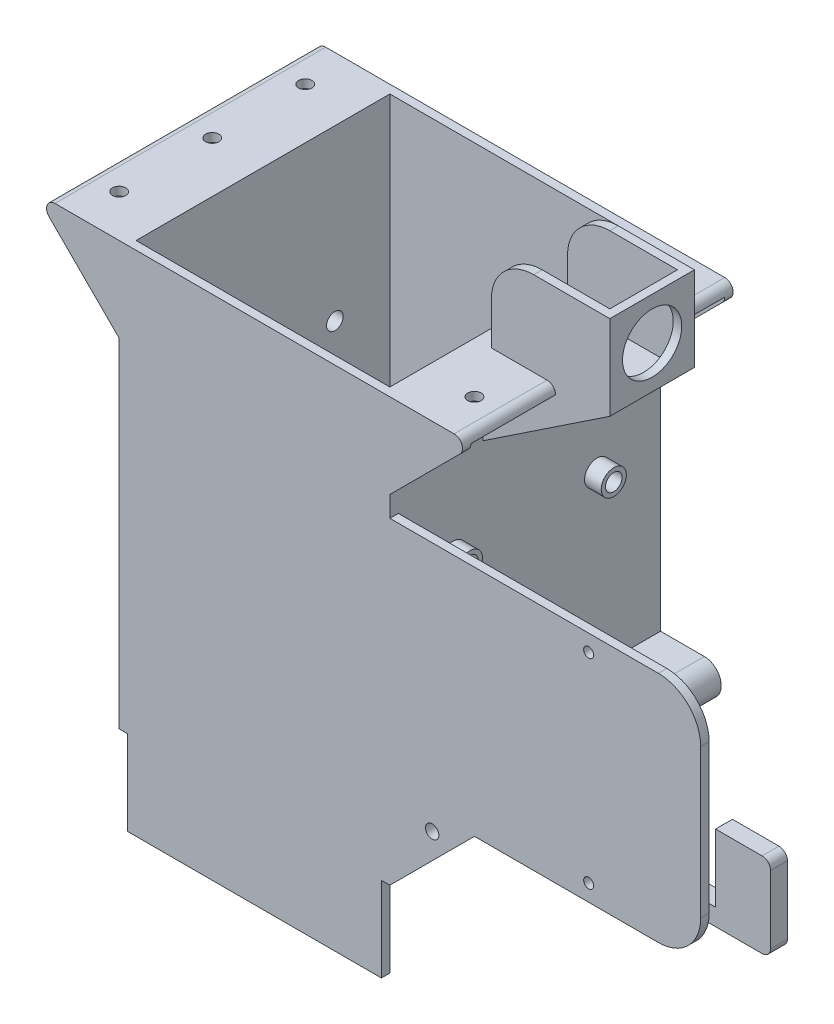
from build123d import *

# Parameters (mm, degrees)
SKETCH1_W            = 81.28
SKETCH1_H            = 81.28
SKETCH1_W_2          = 76.2
SKETCH1_H_2          = 76.2
BOSS_EXTRUDE1_DEPTH  = 177.8
SKETCH2_W            = 2.54
SKETCH2_H            = 38.1
BOSS_EXTRUDE2_DEPTH  = 25.4
SKETCH3_W            = 2.54
SKETCH3_H            = 25.4
CUT_EXTRUDE1_DEPTH   = 212.720846399
BOSS_EXTRUDE3_DEPTH  = 12.7
BOSS_EXTRUDE4_DEPTH  = 12.7
SKETCH14_W           = 5.08
SKETCH14_H           = 25.4
BOSS_EXTRUDE6_DEPTH  = 76.2
CUT_EXTRUDE2_REACH   = 243.407
SKETCH16_W           = 24.13
SKETCH16_H           = 20.32
SKETCH22_R           = 2
CUT_EXTRUDE6_DEPTH   = 252.036309724
SKETCH28_W           = 25.4
SKETCH28_H           = 50.8
BOSS_EXTRUDE7_DEPTH  = 38.1
CUT_EXTRUDE8_REACH   = 245.43
SKETCH32_W           = 33.02
SKETCH32_H           = 20.32
CUT_EXTRUDE9_DEPTH   = 25.4
CUT_EXTRUDE13_REACH  = 245.27
SKETCH34_R           = 8.89
BOSS_EXTRUDE9_DEPTH  = 2.54
SKETCH38_W           = 2.54
SKETCH38_H           = 25.4
CUT_EXTRUDE15_DEPTH  = 63.5
CUT_EXTRUDE17_REACH  = 224.71
SKETCH40_R           = 2.5
BOSS_EXTRUDE10_START = 5
SKETCH41_R           = 3.77
SKETCH41_R_2         = 2.5
BOSS_EXTRUDE10_DEPTH = 5
SKETCH42_R           = 3.77
SKETCH42_R_2         = 2.5
BOSS_EXTRUDE11_DEPTH = 5
SKETCH43_W           = 76.2
SKETCH43_H           = 76.2
CUT_EXTRUDE20_DEPTH  = 25.4
SKETCH44_W           = 174.6
SKETCH44_H           = 70
SKETCH44_R           = 1.5
BOSS_EXTRUDE12_DEPTH = 2.54
BOSS_EXTRUDE13_DEPTH = 2.54
BOSS_EXTRUDE14_DEPTH = 2.54
BOSS_EXTRUDE15_REACH = 264.115
BOSS_EXTRUDE16_DEPTH = 2.54
BOSS_EXTRUDE17_DEPTH = 2.54
BOSS_EXTRUDE18_REACH = 264.115
SKETCH51_R           = 2
CUT_EXTRUDE21_DEPTH  = 2.54
FILLET1_R            = 5.08
FILLET2_R            = 12.7
FILLET3_R            = 2.54
FILLET4_R            = 2.54
FILLET5_R            = 2.54
FILLET7_R            = 12.7
FILLET9_R            = 12.7


with BuildPart() as part:
    # Sketch1 → Boss-Extrude1 (new body)
    with BuildSketch(Plane(origin=(0, 0, 0), x_dir=(1, 0, 0), z_dir=(0, 1, 0))):
        with Locations((40.64, 40.64)):
            Rectangle(SKETCH1_W, SKETCH1_H)
        with Locations((40.64, 40.64)):
            Rectangle(SKETCH1_W_2, SKETCH1_H_2, mode=Mode.SUBTRACT)
    extrude(amount=BOSS_EXTRUDE1_DEPTH)

    # Sketch2 → Boss-Extrude2 (add)
    with BuildSketch(Plane(origin=(0, 0, 0), x_dir=(0, 0, -1), z_dir=(1, 0, 0))):
        with Locations((64.77, 19.05)):
            Rectangle(SKETCH2_W, SKETCH2_H)
    extrude(amount=-BOSS_EXTRUDE2_DEPTH)

    # Sketch3 → Cut-Extrude1 (cut, through all)
    with BuildSketch(Plane.XY):
        with Locations((80.01, 12.7)):
            Rectangle(SKETCH3_W, SKETCH3_H)
    extrude(amount=-CUT_EXTRUDE1_DEPTH, mode=Mode.SUBTRACT)

    # Sketch7 → Boss-Extrude3 (add)
    with BuildSketch(Plane.XY):
        Polygon((81.28, 25.4), (106.68, 50.8), (81.28, 50.8), align=None)
    extrude(amount=-BOSS_EXTRUDE3_DEPTH)

    # Sketch10 → Boss-Extrude4 (add)
    with BuildSketch(Plane(origin=(0, 0, -81.28), x_dir=(-1, 0, 0), z_dir=(0, 0, -1))):
        Polygon((-81.28, 25.4), (-81.28, 50.8), (-106.68, 50.8), align=None)
    extrude(amount=-BOSS_EXTRUDE4_DEPTH)

    # Sketch14 → Boss-Extrude6 (add)
    with BuildSketch(Plane(origin=(81.28, 0, 0), x_dir=(0, 0, -1), z_dir=(1, 0, 0))):
        with Locations((40.64, 38.1)):
            Rectangle(SKETCH14_W, SKETCH14_H)
    extrude(amount=BOSS_EXTRUDE6_DEPTH)

    # Sketch16 → Cut-Extrude2 (cut, up to next)
    with BuildSketch(Plane.XY.offset(-38.1), mode=Mode.PRIVATE) as cut_extrude2_sk1:
        with Locations((128.905, 40.64)):
            Rectangle(SKETCH16_W, SKETCH16_H)
    cut_extrude2_tool1 = extrude(cut_extrude2_sk1.sketch, amount=-CUT_EXTRUDE2_REACH, mode=Mode.PRIVATE) & part.part
    add(cut_extrude2_tool1.solids().sort_by_distance((128.905, 40.64, -38.1))[0], mode=Mode.SUBTRACT)

    # Sketch22 → Cut-Extrude6 (cut, through all)
    with BuildSketch(Plane.XY):
        with Locations((93.98, 45.72)):
            Circle(SKETCH22_R)
    extrude(amount=-CUT_EXTRUDE6_DEPTH, mode=Mode.SUBTRACT)

    # Sketch28 → Boss-Extrude7 (add)
    with BuildSketch(Plane(origin=(81.28, 0, 0), x_dir=(0, 0, -1), z_dir=(1, 0, 0))):
        with Locations((40.64, 152.4)):
            Rectangle(SKETCH28_W, SKETCH28_H)
    extrude(amount=BOSS_EXTRUDE7_DEPTH)

    # Sketch30 → Cut-Extrude8 (cut, up to next)
    with BuildSketch(Plane.XY.offset(-27.94), mode=Mode.PRIVATE) as cut_extrude8_sk1:
        Polygon((81.28, 127), (119.38, 127), (119.38, 152.4), align=None)
    cut_extrude8_tool1 = extrude(cut_extrude8_sk1.sketch, amount=-CUT_EXTRUDE8_REACH, mode=Mode.PRIVATE) & part.part
    add(cut_extrude8_tool1.solids().sort_by_distance((106.68, 135.466667, -27.94))[0], mode=Mode.SUBTRACT)

    # Sketch32 → Cut-Extrude9 (cut)
    with BuildSketch(Plane(origin=(0, 177.8, 0), x_dir=(1, 0, 0), z_dir=(0, 1, 0))):
        with Locations((100.33, 40.64)):
            Rectangle(SKETCH32_W, SKETCH32_H)
    extrude(amount=-CUT_EXTRUDE9_DEPTH, mode=Mode.SUBTRACT)

    # Cut-Extrude13: up to this face of the body (flat: up to its plane)
    cut_extrude13_end = Plane(part.part.faces().sort_by_distance((78.74, 101.6, -40.64))[0])
    # Sketch34 → Cut-Extrude13 (cut, up to the picked face)
    with BuildSketch(Plane(origin=(119.38, 0, 0), x_dir=(0, 0, -1), z_dir=(1, 0, 0)), mode=Mode.PRIVATE) as cut_extrude13_sk1:
        with Locations(Location((40.64, 165.1, 0), (0, 0, 180))):
            Circle(SKETCH34_R)
    cut_extrude13_tool1 = split(extrude(cut_extrude13_sk1.sketch, amount=-CUT_EXTRUDE13_REACH, mode=Mode.PRIVATE), bisect_by=cut_extrude13_end, keep=Keep.BOTH, mode=Mode.PRIVATE)
    add(cut_extrude13_tool1.solids().sort_by(Axis((119.38, 165.1, -40.64), (-1, 0, 0)))[0], mode=Mode.SUBTRACT)

    # Sketch37 → Boss-Extrude9 (add)
    with BuildSketch(Plane.XY.offset(-63.5)):
        Polygon((-25.4, 38.1), (0, 38.1), (0, 52.764696837), align=None)
    extrude(amount=-BOSS_EXTRUDE9_DEPTH)

    # Sketch38 → Cut-Extrude15 (cut)
    with BuildSketch(Plane.XY):
        with Locations((1.27, 12.7)):
            Rectangle(SKETCH38_W, SKETCH38_H)
    extrude(amount=-CUT_EXTRUDE15_DEPTH, mode=Mode.SUBTRACT)

    # Cut-Extrude17: up to this face of the body (flat: up to its plane)
    cut_extrude17_end = Plane(part.part.faces().sort_by_distance((0, 99.23335202, -41.514066738))[0])
    # Sketch40 → Cut-Extrude17 (cut, up to the picked face)
    with BuildSketch(Plane(origin=(81.28, 0, 0), x_dir=(0, 0, -1), z_dir=(1, 0, 0)), mode=Mode.PRIVATE) as cut_extrude17_sk1:
        with Locations((19.05, 101.6)):
            Circle(SKETCH40_R)
    cut_extrude17_tool1 = split(extrude(cut_extrude17_sk1.sketch, amount=-CUT_EXTRUDE17_REACH, mode=Mode.PRIVATE), bisect_by=cut_extrude17_end, keep=Keep.BOTH, mode=Mode.PRIVATE)
    # Sketch40 → Cut-Extrude17 (cut, up to the picked face)
    with BuildSketch(Plane(origin=(81.28, 0, 0), x_dir=(0, 0, -1), z_dir=(1, 0, 0)), mode=Mode.PRIVATE) as cut_extrude17_sk2:
        with Locations((62.23, 101.6)):
            Circle(SKETCH40_R)
    cut_extrude17_tool2 = split(extrude(cut_extrude17_sk2.sketch, amount=-CUT_EXTRUDE17_REACH, mode=Mode.PRIVATE), bisect_by=cut_extrude17_end, keep=Keep.BOTH, mode=Mode.PRIVATE)
    add(cut_extrude17_tool1.solids().sort_by(Axis((81.28, 101.6, -19.05), (-1, 0, 0)))[0], mode=Mode.SUBTRACT)
    add(cut_extrude17_tool2.solids().sort_by(Axis((81.28, 101.6, -62.23), (-1, 0, 0)))[0], mode=Mode.SUBTRACT)

    # Sketch41 → Boss-Extrude10 (add)
    # profile 1 of 2: a face of its own
    with BuildSketch(Plane(origin=(81.28, 0, 0), x_dir=(0, 0, -1), z_dir=(1, 0, 0)).offset(BOSS_EXTRUDE10_START)):
        with Locations(Location((19.05, 101.6, 0), (0, 0, 180))):
            Circle(SKETCH41_R)
        with Locations((19.05, 101.6)):
            Circle(SKETCH41_R_2, mode=Mode.SUBTRACT)
    # profile 2 of 2: a face of its own
    with BuildSketch(Plane(origin=(81.28, 0, 0), x_dir=(0, 0, -1), z_dir=(1, 0, 0)).offset(BOSS_EXTRUDE10_START)):
        with Locations(Location((62.23, 101.6, 0), (0, 0, 180))):
            Circle(SKETCH41_R)
        with Locations((62.23, 101.6)):
            Circle(SKETCH41_R_2, mode=Mode.SUBTRACT)
    extrude(amount=-BOSS_EXTRUDE10_DEPTH)

    # Sketch42 → Boss-Extrude11 (add)
    # profile 1 of 2: a face of its own
    with BuildSketch(Plane.ZY):
        with Locations((-62.23, 101.6)):
            Circle(SKETCH42_R)
        with Locations(Location((-62.23, 101.6, 0), (0, 0, 180))):
            Circle(SKETCH42_R_2, mode=Mode.SUBTRACT)
    # profile 2 of 2: a face of its own
    with BuildSketch(Plane.ZY):
        with Locations((-19.05, 101.6)):
            Circle(SKETCH42_R)
        with Locations(Location((-19.05, 101.6, 0), (0, 0, 180))):
            Circle(SKETCH42_R_2, mode=Mode.SUBTRACT)
    extrude(amount=BOSS_EXTRUDE11_DEPTH)

    # Sketch43 → Cut-Extrude20 (cut)
    with BuildSketch(Plane(origin=(0, 177.8, 0), x_dir=(1, 0, 0), z_dir=(0, 1, 0))):
        Polygon((83.82, 53.34), (83.82, 27.94), (81.28, 27.94), (81.28, 0), (0, 0), (0, 81.28), (81.28, 81.28), (81.28, 53.34), align=None)
        with Locations((40.64, 40.64)):
            Rectangle(SKETCH43_W, SKETCH43_H, mode=Mode.SUBTRACT)
    extrude(amount=-CUT_EXTRUDE20_DEPTH, mode=Mode.SUBTRACT)

    # Sketch44 → Boss-Extrude12 (add)
    with BuildSketch(Plane.XY):
        with Locations((87.3, 85.8)):
            Rectangle(SKETCH44_W, SKETCH44_H)
        with Locations((140.97, 115.8)):
            Circle(SKETCH44_R, mode=Mode.SUBTRACT)
        with Locations((140.97, 55.8)):
            Circle(SKETCH44_R, mode=Mode.SUBTRACT)
    extrude(amount=-BOSS_EXTRUDE12_DEPTH)

    # Sketch45 → Boss-Extrude13 (add)
    with BuildSketch(Plane.XY):
        Polygon((0, 152.4), (-25.4, 152.4), (0, 127), align=None)
    extrude(amount=-BOSS_EXTRUDE13_DEPTH)

    # Sketch46 → Boss-Extrude14 (add)
    with BuildSketch(Plane(origin=(0, 0, -81.28), x_dir=(-1, 0, 0), z_dir=(0, 0, -1))):
        Polygon((0, 152.4), (0, 127), (25.4, 152.4), align=None)
    extrude(amount=-BOSS_EXTRUDE14_DEPTH)

    # Sketch47 → Boss-Extrude15 (add, up to next)
    with BuildSketch(Plane.XY, mode=Mode.PRIVATE) as boss_extrude15_sk1:
        Polygon((0, 152.4), (-25.4, 152.4), (-22.86, 149.86), (0, 149.86), align=None)
    boss_extrude15_tool1 = extrude(boss_extrude15_sk1.sketch, amount=-BOSS_EXTRUDE15_REACH, mode=Mode.PRIVATE) - part.part
    add(boss_extrude15_tool1.solids().sort_by_distance((-12.07614, 151.152281, 0))[0])

    # Sketch48 → Boss-Extrude16 (add)
    with BuildSketch(Plane.XY):
        Polygon((81.28, 152.4), (106.68, 152.4), (81.28, 127), align=None)
    extrude(amount=-BOSS_EXTRUDE16_DEPTH)

    # Sketch49 → Boss-Extrude17 (add)
    with BuildSketch(Plane(origin=(0, 0, -81.28), x_dir=(-1, 0, 0), z_dir=(0, 0, -1))):
        Polygon((-81.28, 152.4), (-106.68, 152.4), (-81.28, 127), align=None)
    extrude(amount=-BOSS_EXTRUDE17_DEPTH)

    # Sketch50 → Boss-Extrude18 (add, up to next)
    with BuildSketch(Plane(origin=(0, 0, -81.28), x_dir=(-1, 0, 0), z_dir=(0, 0, -1)), mode=Mode.PRIVATE) as boss_extrude18_sk1:
        Polygon((-81.28, 152.4), (-106.68, 152.4), (-104.14, 149.86), (-81.28, 149.86), align=None)
    boss_extrude18_tool1 = extrude(boss_extrude18_sk1.sketch, amount=-BOSS_EXTRUDE18_REACH, mode=Mode.PRIVATE) - part.part
    add(boss_extrude18_tool1.solids().sort_by_distance((93.35614, 151.152281, -81.28))[0])
    add(boss_extrude18_tool1.solids().sort_by_distance((93.35614, 151.152281, -81.28))[1])

    # Sketch51 → Cut-Extrude21 (cut)
    with BuildSketch(Plane(origin=(0, 152.4, 0), x_dir=(1, 0, 0), z_dir=(0, 1, 0))):
        with Locations(Location((-12.7, 68.58, 0), (0, 0, 270))):
            Circle(SKETCH51_R)
        with Locations(Location((-12.7, 40.64, 0), (0, 0, 270))):
            Circle(SKETCH51_R)
        with Locations(Location((-12.7, 12.7, 0), (0, 0, 270))):
            Circle(SKETCH51_R)
        with Locations(Location((93.98, 68.58, 0), (0, 0, 270))):
            Circle(SKETCH51_R)
        with Locations(Location((93.98, 12.7, 0), (0, 0, 270))):
            Circle(SKETCH51_R)
    extrude(amount=-CUT_EXTRUDE21_DEPTH, mode=Mode.SUBTRACT)

    # Fillet1
    fillet1_edges = [part.edges().sort_by_distance(p)[0] for p in [
        (106.68, 50.8, -7.62),
        (106.68, 50.8, -74.93),
    ]]
    fillet(fillet1_edges, radius=FILLET1_R)

    # Fillet2
    fillet2_edges = [part.edges().sort_by_distance(p)[0] for p in [
        (174.6, 120.8, -1.27),
        (174.6, 50.8, -1.27),
    ]]
    fillet(fillet2_edges, radius=FILLET2_R)

    # Fillet3
    fillet3_edges = [part.edges().sort_by_distance(p)[0] for p in [
        (157.48, 50.8, -40.64),
        (157.48, 25.4, -40.64),
    ]]
    fillet(fillet3_edges, radius=FILLET3_R)

    # Fillet4
    # the kernel refuses this fillet: 2.54 mm, written as the material it takes off along each edge
    with BuildSketch(Plane(origin=(-25.4, 152.4, 15.330256121), x_dir=(1, 0, 0), z_dir=(0, 0, -1))) as fillet4_piece_1:
        with BuildLine():
            CenterArc((FILLET4_R * 2.41421356237, FILLET4_R), FILLET4_R, 135, 135)
            Line((FILLET4_R * 1.70710678119, FILLET4_R * 1.70710678119), (0, 0))
            Line((0, 0), (FILLET4_R * 2.41421356237, 0))
        make_face()
    extrude(amount=111.940512242, mode=Mode.SUBTRACT)

    # Fillet5
    fillet5_edges = [part.edges().sort_by_distance(p)[0] for p in [
        (106.68, 152.4, -67.31),
        (106.68, 152.4, -13.97),
    ]]
    fillet(fillet5_edges, radius=FILLET5_R)

    # Fillet7
    fillet7_edges = [part.edges().sort_by_distance(p)[0] for p in [
        (-25.4, 38.1, -64.77),
    ]]
    fillet(fillet7_edges, radius=FILLET7_R)

    # Fillet9
    fillet9_edges = [part.edges().sort_by_distance(p)[0] for p in [
        (83.82, 177.8, -29.21),
        (83.82, 177.8, -52.07),
    ]]
    fillet(fillet9_edges, radius=FILLET9_R)


solid = part.part
